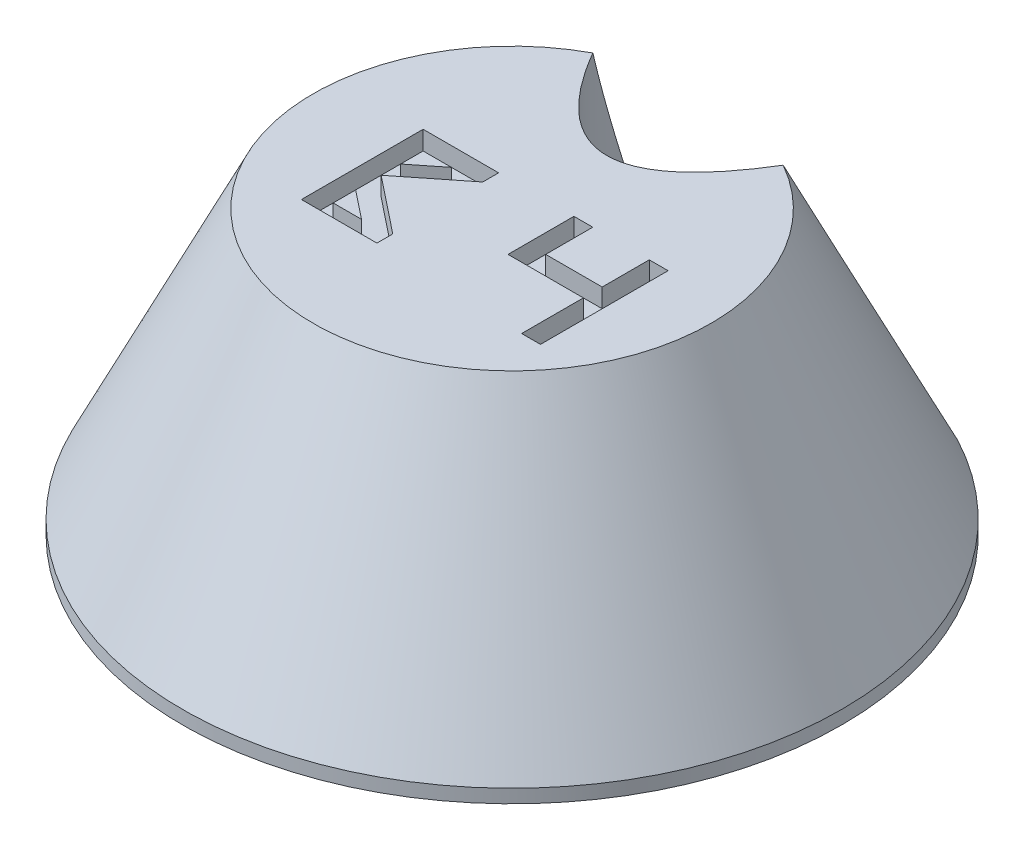
from build123d import *

# Parameters (mm, degrees)
BOSS_EXTRUDE2_DEPTH = 15
CUT_EXTRUDE1_DEPTH  = 1


# Read off the part's stored shape, not the designer's step: Cut-Revolve-Thin2
with BuildPart() as part:
    # Sketch2 → Boss-Extrude2 (new body)
    with BuildSketch(Plane(origin=(0, 0, 0), x_dir=(1, 0, 0), z_dir=(0, 1, 0))):
        with BuildLine():
            ThreePointArc((-7.860899149, 15.635097204), (-0.183301368, -17.499039991), (8.1866917, 15.466999677))
            add(Edge.make_bspline(
                [(-7.860899149, 15.635097204), (-0.059171416, -5.64885573), (8.1866917, 15.466999677)],
                knots=[0, 0, 0, 1, 1, 1], degree=2))
        make_face()
    extrude(amount=BOSS_EXTRUDE2_DEPTH)

    # Cut-Revolve-Thin2 outline → Cut-Revolve-Thin2 (revolve, cut)
    with BuildSketch(Plane.XY):
        Polygon((17.5, 15), (10.561985935, 15), (17.5, 0.715896694), align=None)
    revolve(axis=Axis((0, 0, 0), (0, 1, 0)), mode=Mode.SUBTRACT)

    # Sketch8 → Cut-Extrude1 (cut)
    # profile 1 of 2: a face of its own
    with BuildSketch(Plane(origin=(0, 15, 0), x_dir=(1, 0, 0), z_dir=(0, 1, 0))):
        Polygon((-6.00797666, 1.283695301), (-6.00797666, -5.177491307), (-2, -5.177491307), (-2, -4.335596537), (-5.00797666, -1.946898003), (-2, 0.441800531), (-2, 1.283695301), align=None)
        Polygon((-3.50398833, -4.493701766), (-5.00797666, -4.493701766), (-5.00797666, -3.2993525), align=None, mode=Mode.SUBTRACT)
        Polygon((-5.00797666, 0.283695301), (-3.50398833, 0.283695301), (-5.00797666, -0.910653966), align=None, mode=Mode.SUBTRACT)
    # profile 2 of 2: a face of its own
    with BuildSketch(Plane(origin=(0, 15, 0), x_dir=(1, 0, 0), z_dir=(0, 1, 0))):
        Polygon((2, 1.283695301), (3, 1.283695301), (3, -1.216304699), (6, -1.216304699), (6, 1.283695301), (7, 1.283695301), (7, -5.493701766), (6, -5.493701766), (6, -2.216304699), (2, -2.216304699), align=None)
    extrude(amount=-CUT_EXTRUDE1_DEPTH, mode=Mode.SUBTRACT)


solid = part.part
